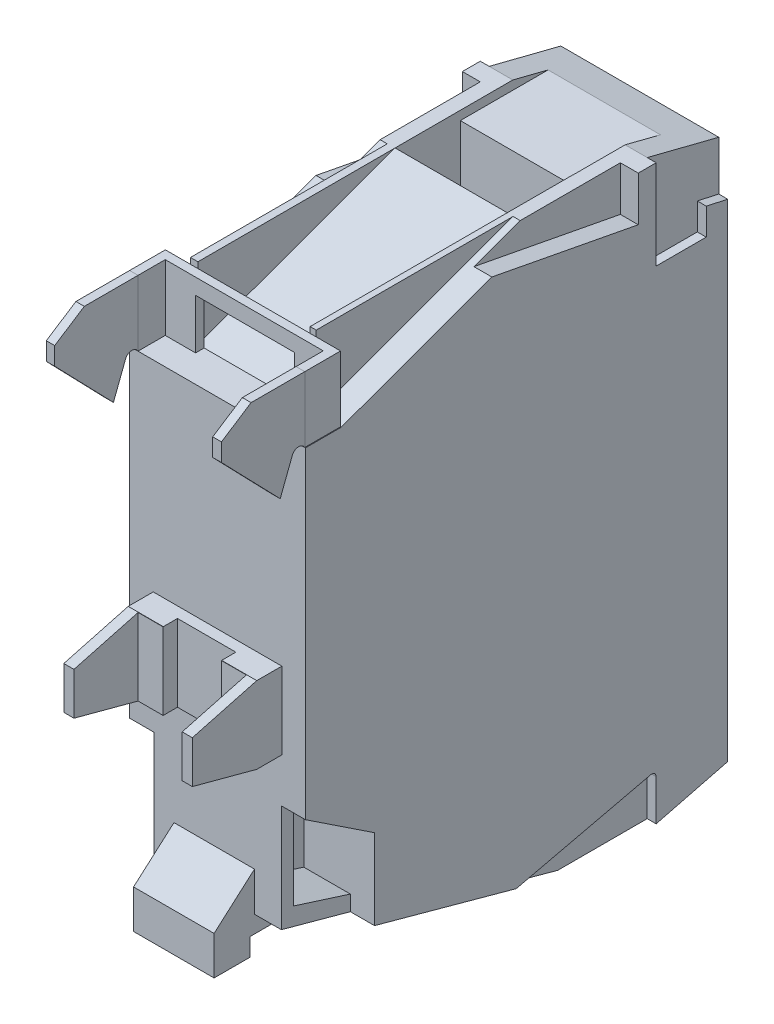
from build123d import *
from OCP.BRepFilletAPI import BRepFilletAPI_MakeChamfer

# Parameters (mm, degrees)
SKETCH1_W                = 9.83
SKETCH1_H                = 32
BOSS_EXTRUDE1_DEPTH      = 23.6
CUT_EXTRUDE1_REACH       = 32.159
CUT_EXTRUDE2_DEPTH       = 0.5
CUT_EXTRUDE3_DEPTH       = 0.5
CUT_EXTRUDE4_REACH       = 32.159
CUT_EXTRUDE5_DEPTH       = 0.5
CUT_EXTRUDE6_DEPTH       = 0.5
CUT_EXTRUDE7_REACH       = 32.159
SKETCH9_W                = 2
SKETCH9_H                = 4
CUT_EXTRUDE8_DEPTH       = 1
CUT_EXTRUDE9_DEPTH       = 1.4
CUT_EXTRUDE10_DEPTH      = 1
CUT_EXTRUDE11_DEPTH      = 1.4
CUT_EXTRUDE12_DEPTH      = 1.35
CUT_EXTRUDE13_DEPTH      = 1.35
CUT_EXTRUDE14_DEPTH      = 2.6
CUT_EXTRUDE15_DEPTH      = 3.6
SKETCH19_W               = 7.182897737
SKETCH19_H               = 2.178759377
CUT_EXTRUDE18_DEPTH      = 1.32
SKETCH21_W               = 8.285586635
SKETCH21_H               = 5.463762064
CUT_EXTRUDE19_DEPTH      = 4.25
BOSS_EXTRUDE2_DEPTH      = 2.25
BOSS_EXTRUDE2_DEPTH_BACK = 2.25
SKETCH23_W               = 6.27247625
SKETCH23_H               = 14.666987047
CUT_EXTRUDE20_DEPTH      = 4
BOSS_EXTRUDE3_REACH      = 33.466
SKETCH25_W               = 6.279577339
SKETCH25_H               = 6.156082968
CUT_EXTRUDE21_DEPTH      = 0.5
SKETCH26_W               = 7.185798512
SKETCH26_H               = 4.295592105
CUT_EXTRUDE22_DEPTH      = 31.802589265
BOSS_EXTRUDE4_DEPTH      = 5
BOSS_EXTRUDE4_DEPTH_BACK = 19.5
SKETCH27_W               = 7.185798512
SKETCH27_H               = 4.295592105
CUT_EXTRUDE23_DEPTH      = 4.295592
CHAMFER3_SIZE            = 3.6
CHAMFER3_SIZE2           = 0.964617093
CHAMFER4_SIZE            = 3.6
CHAMFER4_SIZE2           = 0.964617093
SKETCH29_W               = 3.499012957
SKETCH29_H               = 4.183403899
BOSS_EXTRUDE5_DEPTH      = 0.25
SKETCH30_R               = 2.75
SKETCH30_W               = 8.613757753
SKETCH30_H               = 3.512782784
CUT_EXTRUDE24_DEPTH      = 4
SKETCH31_R               = 2.75
CUT_EXTRUDE25_DEPTH      = 1
SKETCH32_R               = 2.75
BOSS_EXTRUDE6_DEPTH      = 0.75
BOSS_EXTRUDE6_2_DEPTH    = 0.75
SKETCH33_W               = 0.622313759
SKETCH33_H               = 4.486215778
SKETCH33_W_2             = 2.91691535
SKETCH33_H_2             = 0.583263223
SKETCH33_H_3             = 0.583263224
SKETCH33_H_4             = 4.486215777
CUT_EXTRUDE26_DEPTH      = 0.75
SKETCH35_W               = 9.791059678
SKETCH35_H               = 3.669794899
BOSS_EXTRUDE8_DEPTH      = 2
BOSS_EXTRUDE9_DEPTH      = 9.79106
SKETCH38_W               = 8.832235424
SKETCH38_H               = 8.039772077
CUT_EXTRUDE32_DEPTH      = 3.669795
CUT_EXTRUDE33_START      = -1.795116
SKETCH41_W               = 8.832235424
SKETCH41_H               = 2.428139179
CUT_EXTRUDE33_DEPTH      = 1.795116
CUT_EXTRUDE34_START      = -22.077145
SKETCH42_W               = 5.516661754
SKETCH42_H               = 2.788600357
CUT_EXTRUDE34_DEPTH      = 28.6
CUT_EXTRUDE35_DEPTH      = 0.01


with BuildPart() as part:
    # Sketch1 → Boss-Extrude1 (new body)
    with BuildSketch(Plane.XY):
        Rectangle(SKETCH1_W, SKETCH1_H)
    extrude(amount=BOSS_EXTRUDE1_DEPTH)

    # Sketch2 → Cut-Extrude1 (cut, up to next)
    with BuildSketch(Plane(origin=(4.915, 0, 0), x_dir=(0, 0, -1), z_dir=(1, 0, 0)), mode=Mode.PRIVATE) as cut_extrude1_sk1:
        Polygon((-4, 16), (0, 14.985828567), (0, 16), align=None)
    cut_extrude1_tool1 = extrude(cut_extrude1_sk1.sketch, amount=-CUT_EXTRUDE1_REACH, mode=Mode.PRIVATE) & part.part
    # Sketch2 → Cut-Extrude1 (cut, up to next)
    with BuildSketch(Plane(origin=(4.915, 0, 0), x_dir=(0, 0, -1), z_dir=(1, 0, 0)), mode=Mode.PRIVATE) as cut_extrude1_sk2:
        Polygon((0, -16), (0, -14.985828567), (-4, -16), align=None)
    cut_extrude1_tool2 = extrude(cut_extrude1_sk2.sketch, amount=-CUT_EXTRUDE1_REACH, mode=Mode.PRIVATE) & part.part
    add(cut_extrude1_tool1.solids().sort_by_distance((4.915, 15.661943, 1.333333))[0], mode=Mode.SUBTRACT)
    add(cut_extrude1_tool2.solids().sort_by_distance((4.915, -15.661943, 1.333333))[0], mode=Mode.SUBTRACT)

    # Sketch5 → Cut-Extrude2 (cut)
    with BuildSketch(Plane.ZY.offset(4.915)):
        Polygon((4, 16), (4, 11), (1.2, 11), (1.2, 12.5), (0, 12.235925398), (0, 14.985828567), align=None)
    extrude(amount=-CUT_EXTRUDE2_DEPTH, mode=Mode.SUBTRACT)

    # Sketch3 → Cut-Extrude3 (cut)
    with BuildSketch(Plane(origin=(4.915, 0, 0), x_dir=(0, 0, -1), z_dir=(1, 0, 0))):
        Polygon((-4, 16), (-4, 11), (-1.2, 11), (-1.2, 12.5), (0, 12.235925398), (0, 14.985828567), align=None)
    extrude(amount=-CUT_EXTRUDE3_DEPTH, mode=Mode.SUBTRACT)

    # Sketch6 → Cut-Extrude4 (cut, up to next)
    with BuildSketch(Plane(origin=(4.915, 0, 0), x_dir=(0, 0, -1), z_dir=(1, 0, 0)), mode=Mode.PRIVATE) as cut_extrude4_sk1:
        Polygon((-23.6, -12), (-9, -16), (-23.6, -16), align=None)
    cut_extrude4_tool1 = extrude(cut_extrude4_sk1.sketch, amount=-CUT_EXTRUDE4_REACH, mode=Mode.PRIVATE) & part.part
    add(cut_extrude4_tool1.solids().sort_by_distance((4.915, -14.666667, 18.733333))[0], mode=Mode.SUBTRACT)

    # Sketch7 → Cut-Extrude5 (cut)
    with BuildSketch(Plane(origin=(4.915, 0, 0), x_dir=(0, 0, -1), z_dir=(1, 0, 0))):
        with BuildLine():
            Line((-4, -16), (-4, -13.715163243))
            ThreePointArc((-4, -13.715163243), (-4.09463494, -13.519301818), (-4.306893584, -13.471723066))
            Line((-4.306893584, -13.471723066), (-11.819628513, -15.227499038))
            Line((-11.819628513, -15.227499038), (-9, -16))
            Line((-9, -16), (-4, -16))
        make_face()
    extrude(amount=-CUT_EXTRUDE5_DEPTH, mode=Mode.SUBTRACT)

    # Sketch8 → Cut-Extrude6 (cut)
    with BuildSketch(Plane.ZY.offset(4.915)):
        Polygon((4, -16), (4, -13.715163243), (4.09463494, -13.519301818), (4.306893584, -13.471723066), (11.819628513, -15.227499038), (9, -16), align=None)
    extrude(amount=-CUT_EXTRUDE6_DEPTH, mode=Mode.SUBTRACT)

    # Sketch9 → Cut-Extrude7 (cut, up to next)
    with BuildSketch(Plane(origin=(4.915, 0, 0), x_dir=(0, 0, -1), z_dir=(1, 0, 0)), mode=Mode.PRIVATE) as cut_extrude7_sk1:
        with Locations((-22.6, 14)):
            Rectangle(SKETCH9_W, SKETCH9_H)
    cut_extrude7_tool1 = extrude(cut_extrude7_sk1.sketch, amount=-CUT_EXTRUDE7_REACH, mode=Mode.PRIVATE) & part.part
    add(cut_extrude7_tool1.solids().sort_by_distance((4.915, 14, 22.6))[0], mode=Mode.SUBTRACT)

    # Sketch10 → Cut-Extrude8 (cut)
    with BuildSketch(Plane(origin=(4.915, 0, 0), x_dir=(0, 0, -1), z_dir=(1, 0, 0))):
        Polygon((-5, 13.5), (-5, 16), (-18.10239553, 16), align=None)
    extrude(amount=-CUT_EXTRUDE8_DEPTH, mode=Mode.SUBTRACT)

    # Sketch11 → Cut-Extrude9 (cut)
    with BuildSketch(Plane(origin=(4.915, 0, 0), x_dir=(0, 0, -1), z_dir=(1, 0, 0))):
        Polygon((-21.6, 16), (-10.6, 16), (-21.6, 12), align=None)
    extrude(amount=-CUT_EXTRUDE9_DEPTH, mode=Mode.SUBTRACT)

    # Sketch12 → Cut-Extrude10 (cut)
    with BuildSketch(Plane.ZY.offset(4.915)):
        Polygon((5, 16), (5, 13.5), (18.10239553, 16), align=None)
    extrude(amount=-CUT_EXTRUDE10_DEPTH, mode=Mode.SUBTRACT)

    # Sketch13 → Cut-Extrude11 (cut)
    with BuildSketch(Plane.ZY.offset(4.915)):
        Polygon((21.6, 12), (21.6, 16), (10.6, 16), align=None)
    extrude(amount=-CUT_EXTRUDE11_DEPTH, mode=Mode.SUBTRACT)

    # Sketch14 → Cut-Extrude12 (cut)
    with BuildSketch(Plane(origin=(4.915, 0, 0), x_dir=(0, 0, -1), z_dir=(1, 0, 0))):
        Polygon((-23.6, -12), (-23.6, -6), (-19.742166853, -8.556940588), (-19.742166853, -13.056940588), align=None)
    extrude(amount=-CUT_EXTRUDE12_DEPTH, mode=Mode.SUBTRACT)

    # Sketch15 → Cut-Extrude13 (cut)
    with BuildSketch(Plane.ZY.offset(4.915)):
        Polygon((19.742166853, -13.056940588), (19.742166853, -8.556940588), (23.6, -6), (23.6, -12), align=None)
    extrude(amount=-CUT_EXTRUDE13_DEPTH, mode=Mode.SUBTRACT)

    # Sketch16 → Cut-Extrude14 (cut)
    with BuildSketch(Plane(origin=(3.565, 0, 0), x_dir=(0, 0, -1), z_dir=(1, 0, 0))):
        Polygon((-22.922592203, -6.448980406), (-22.922592203, -11.190433252), (-19.742166853, -12.201066505), (-19.742166853, -8.556940588), align=None)
    extrude(amount=-CUT_EXTRUDE14_DEPTH, mode=Mode.SUBTRACT)

    # Sketch18 → Cut-Extrude15 (cut)
    with BuildSketch(Plane.ZY.offset(3.565)):
        Polygon((19.742166853, -12.201066505), (19.742166853, -8.556940588), (22.922592203, -6.448980406), (22.922592203, -11.190433252), align=None)
    extrude(amount=-CUT_EXTRUDE15_DEPTH, mode=Mode.SUBTRACT)

    # Sketch19 → Cut-Extrude18 (cut)
    with BuildSketch(Plane(origin=(0, -14.080667223, -3.570052614), x_dir=(1, 0, 0), z_dir=(0, -0.9693290698641888, -0.2457664629607274))):
        with Locations((0.133177719, 6.014201082)):
            Rectangle(SKETCH19_W, SKETCH19_H)
    extrude(amount=-CUT_EXTRUDE18_DEPTH, mode=Mode.SUBTRACT)

    # Chamfer2
    # the kernel refuses this chamfer: 2.799038106, 0.75 mm, written as the material it takes off along each edge
    with BuildSketch(Plane(origin=(-3.45827115, -15.826489143, 3.315654727), x_dir=(-0.9905000388259536, -0.13329481236589955, -0.033795947717498075), z_dir=(0, 0.24576646296072743, -0.9693290698641889))) as chamfer2_piece_1_section:
        with BuildLine():
            Line((0.78644901, 0), (-0.42847656, 2.875581688))
            Line((-0.42847656, 2.875581688), (-0.483925507, 2.867883636))
            ThreePointArc((-0.483925507, 2.867883636), (-0.255335983, 1.432085195), (-0.055448947, -0.007698052))
            Line((-0.055448947, -0.007698052), (0.007698052, -0.055448947))
            ThreePointArc((0.007698052, -0.055448947), (0.39348681, -0.001889377), (0.794147061, -0.055448947))
            Line((0.794147061, -0.055448947), (0.78644901, 0))
        make_face()
    chamfer2_piece_1 = extrude(amount=2.178759377, mode=Mode.PRIVATE)
    chamfer2_piece_1 = split(chamfer2_piece_1, bisect_by=Plane(origin=(-3.7390551, -14.279241778, 2.584099058), z_dir=(0, -0.9693290698641888, -0.2457664629607274)), keep=Keep.TOP, mode=Mode.PRIVATE)
    add(chamfer2_piece_1, mode=Mode.SUBTRACT)
    with BuildSketch(Plane(origin=(-3.45827115, -15.291023158, 1.203719926), x_dir=(0, 0.11013687873881672, -0.9939164290531027), z_dir=(1, 0, 0))) as chamfer2_piece_2_section:
        with BuildLine():
            Line((0.78644901, 0), (-0.42847656, 2.875581688))
            Line((-0.42847656, 2.875581688), (-0.483925507, 2.867883636))
            ThreePointArc((-0.483925507, 2.867883636), (-0.255335983, 1.432085195), (-0.055448947, -0.007698052))
            Line((-0.055448947, -0.007698052), (0.007698052, -0.055448947))
            ThreePointArc((0.007698052, -0.055448947), (0.39348681, -0.001889377), (0.794147061, -0.055448947))
            Line((0.794147061, -0.055448947), (0.78644901, 0))
        make_face()
    chamfer2_piece_2 = extrude(amount=7.182897736, mode=Mode.PRIVATE)
    chamfer2_piece_2 = split(chamfer2_piece_2, bisect_by=Plane(origin=(0.133177718, -13.942501507, 1.255959612), z_dir=(0, -0.9693290698641888, -0.2457664629607274)), keep=Keep.TOP, mode=Mode.PRIVATE)
    add(chamfer2_piece_2, mode=Mode.SUBTRACT)
    with BuildSketch(Plane(origin=(3.724626587, -15.291023158, 1.203719926), x_dir=(0.9905000388259536, -0.1332948123658999, -0.03379594771749775), z_dir=(0, -0.24576646296072743, 0.9693290698641889))) as chamfer2_piece_3_section:
        with BuildLine():
            Line((0.78644901, 0), (-0.42847656, 2.875581688))
            Line((-0.42847656, 2.875581688), (-0.483925507, 2.867883636))
            ThreePointArc((-0.483925507, 2.867883636), (-0.255335983, 1.432085195), (-0.055448947, -0.007698052))
            Line((-0.055448947, -0.007698052), (0.007698052, -0.055448947))
            ThreePointArc((0.007698052, -0.055448947), (0.39348681, -0.001889377), (0.794147061, -0.055448947))
            Line((0.794147061, -0.055448947), (0.78644901, 0))
        make_face()
    chamfer2_piece_3 = extrude(amount=2.178759377, mode=Mode.PRIVATE)
    chamfer2_piece_3 = split(chamfer2_piece_3, bisect_by=Plane(origin=(4.005410537, -14.279241778, 2.584099058), z_dir=(0, -0.9693290698641888, -0.2457664629607274)), keep=Keep.TOP, mode=Mode.PRIVATE)
    add(chamfer2_piece_3, mode=Mode.SUBTRACT)
    with BuildSketch(Plane(origin=(-10.726593775, -15.291023158, 1.203719926), x_dir=(0, 0.11013687873882122, -0.9939164290531021), z_dir=(1, 0, 0))) as chamfer2_piece_4a_section:
        with BuildLine():
            Line((0.78644901, 0), (-0.42847656, 2.875581688))
            Line((-0.42847656, 2.875581688), (-0.483925507, 2.867883636))
            ThreePointArc((-0.483925507, 2.867883636), (-0.255335983, 1.432085195), (-0.055448947, -0.007698052))
            Line((-0.055448947, -0.007698052), (0.007698052, -0.055448947))
            ThreePointArc((0.007698052, -0.055448947), (0.39348681, -0.001889377), (0.794147061, -0.055448947))
            Line((0.794147061, -0.055448947), (0.78644901, 0))
        make_face()
    chamfer2_piece_4a = extrude(amount=14.451220361, mode=Mode.PRIVATE)
    chamfer2_piece_4a = split(chamfer2_piece_4a, bisect_by=Plane(origin=(-3.45827115, -14.683152158, 1.068172929), z_dir=(-1, 0, 0)), keep=Keep.TOP, mode=Mode.PRIVATE)
    chamfer2_piece_4a = split(chamfer2_piece_4a, bisect_by=Plane(origin=(-7.092432462, -13.942501507, 1.255959612), z_dir=(0, -0.9693290698641888, -0.2457664629607274)), keep=Keep.TOP, mode=Mode.PRIVATE)
    with BuildSketch(Plane(origin=(-3.45827115, -15.826489143, 3.315654727), x_dir=(-0.9905000388259536, -0.13329481236589955, -0.033795947717498075), z_dir=(0, 0.24576646296072743, -0.9693290698641889))) as chamfer2_piece_4b_section:
        with BuildLine():
            Line((0.78644901, 0), (-0.42847656, 2.875581688))
            Line((-0.42847656, 2.875581688), (-0.483925507, 2.867883636))
            ThreePointArc((-0.483925507, 2.867883636), (-0.255335983, 1.432085195), (-0.055448947, -0.007698052))
            Line((-0.055448947, -0.007698052), (0.007698052, -0.055448947))
            ThreePointArc((0.007698052, -0.055448947), (0.39348681, -0.001889377), (0.794147061, -0.055448947))
            Line((0.794147061, -0.055448947), (0.78644901, 0))
        make_face()
    chamfer2_piece_4b = extrude(amount=9.447082002, mode=Mode.PRIVATE)
    chamfer2_piece_4b = split(chamfer2_piece_4b, bisect_by=Plane(origin=(-3.7390551, -14.752159437, 1.340344974), z_dir=(0, 0.24576646296072743, -0.9693290698641889)), keep=Keep.TOP, mode=Mode.PRIVATE)
    chamfer2_piece_4b = split(chamfer2_piece_4b, bisect_by=Plane(origin=(-3.7390551, -13.118353814, -1.994566548), z_dir=(0, -0.9693290698641888, -0.2457664629607274)), keep=Keep.TOP, mode=Mode.PRIVATE)
    chamfer2_piece_4 = chamfer2_piece_4a & chamfer2_piece_4b
    add(chamfer2_piece_4, mode=Mode.SUBTRACT)
    with BuildSketch(Plane(origin=(3.724626587, -13.504713214, -5.841676483), x_dir=(0.9905000388259537, -0.13329481236589816, -0.0337959477174973), z_dir=(0, -0.24576646296072743, 0.9693290698641889))) as chamfer2_piece_5a_section:
        with BuildLine():
            Line((0.78644901, 0), (-0.42847656, 2.875581688))
            Line((-0.42847656, 2.875581688), (-0.483925507, 2.867883636))
            ThreePointArc((-0.483925507, 2.867883636), (-0.255335983, 1.432085195), (-0.055448947, -0.007698052))
            Line((-0.055448947, -0.007698052), (0.007698052, -0.055448947))
            ThreePointArc((0.007698052, -0.055448947), (0.39348681, -0.001889377), (0.794147061, -0.055448947))
            Line((0.794147061, -0.055448947), (0.78644901, 0))
        make_face()
    chamfer2_piece_5a = extrude(amount=9.447082002, mode=Mode.PRIVATE)
    chamfer2_piece_5a = split(chamfer2_piece_5a, bisect_by=Plane(origin=(4.005410537, -14.752159437, 1.340344974), z_dir=(0, 0.24576646296072743, -0.9693290698641889)), keep=Keep.TOP, mode=Mode.PRIVATE)
    chamfer2_piece_5a = split(chamfer2_piece_5a, bisect_by=Plane(origin=(4.005410537, -13.118353814, -1.994566548), z_dir=(0, -0.9693290698641888, -0.2457664629607274)), keep=Keep.TOP, mode=Mode.PRIVATE)
    with BuildSketch(Plane(origin=(-3.45827115, -15.291023158, 1.203719926), x_dir=(0, 0.11013687873881672, -0.9939164290531027), z_dir=(1, 0, 0))) as chamfer2_piece_5b_section:
        with BuildLine():
            Line((0.78644901, 0), (-0.42847656, 2.875581688))
            Line((-0.42847656, 2.875581688), (-0.483925507, 2.867883636))
            ThreePointArc((-0.483925507, 2.867883636), (-0.255335983, 1.432085195), (-0.055448947, -0.007698052))
            Line((-0.055448947, -0.007698052), (0.007698052, -0.055448947))
            ThreePointArc((0.007698052, -0.055448947), (0.39348681, -0.001889377), (0.794147061, -0.055448947))
            Line((0.794147061, -0.055448947), (0.78644901, 0))
        make_face()
    chamfer2_piece_5b = extrude(amount=14.451220361, mode=Mode.PRIVATE)
    chamfer2_piece_5b = split(chamfer2_piece_5b, bisect_by=Plane(origin=(3.724626587, -14.683152158, 1.068172929), z_dir=(1, 0, 0)), keep=Keep.TOP, mode=Mode.PRIVATE)
    chamfer2_piece_5b = split(chamfer2_piece_5b, bisect_by=Plane(origin=(7.358787899, -13.942501507, 1.255959612), z_dir=(0, -0.9693290698641888, -0.2457664629607274)), keep=Keep.TOP, mode=Mode.PRIVATE)
    chamfer2_piece_5 = chamfer2_piece_5a & chamfer2_piece_5b
    add(chamfer2_piece_5, mode=Mode.SUBTRACT)

    # Sketch21 → Cut-Extrude19 (cut)
    with BuildSketch(Plane(origin=(0, -14.080667223, -3.570052614), x_dir=(-1, 0, 0), z_dir=(0, -0.9693290698641888, -0.2457664629607274))):
        with Locations((0.065477832, -9.835461802)):
            Rectangle(SKETCH21_W, SKETCH21_H)
    extrude(amount=-CUT_EXTRUDE19_DEPTH, mode=Mode.SUBTRACT)

    # Sketch22 → Boss-Extrude2 (add, two sides: drawn at the far end of the back side and taken through both)
    with BuildSketch(Plane(origin=(-0.185, 0, 0), x_dir=(0, 0, -1), z_dir=(1, 0, 0)).offset(-BOSS_EXTRUDE2_DEPTH_BACK)):
        Polygon((-19.858118269, -12.957237014), (-23.858118269, -12.957237014), (-23.858118269, -13.957237014), (-25.858118269, -13.957237014), (-25.858118269, -11.798752032), (-23.592707946, -9.808092274), (-23.473074349, -11.374374647), align=None)
    extrude(amount=BOSS_EXTRUDE2_DEPTH + BOSS_EXTRUDE2_DEPTH_BACK)

    # Sketch23 → Cut-Extrude20 (cut)
    with BuildSketch(Plane(origin=(0, 16, 0), x_dir=(1, 0, 0), z_dir=(0, 1, 0))):
        with Locations((0.038081978, -14.266506477)):
            Rectangle(SKETCH23_W, SKETCH23_H)
    extrude(amount=-CUT_EXTRUDE20_DEPTH, mode=Mode.SUBTRACT)

    # Sketch24 → Boss-Extrude3 (add, up to next)
    with BuildSketch(Plane.ZY.offset(-3.174320103), mode=Mode.PRIVATE) as boss_extrude3_sk1:
        Polygon((10.579716493, 16), (21.6, 12), (10.579716493, 12), align=None)
    boss_extrude3_tool1 = extrude(boss_extrude3_sk1.sketch, amount=BOSS_EXTRUDE3_REACH, mode=Mode.PRIVATE) - part.part
    add(boss_extrude3_tool1.solids().sort_by_distance((3.17432, 13.333333, 14.253144))[0])

    # Sketch25 → Cut-Extrude21 (cut)
    with BuildSketch(Plane(origin=(0, 16, 0), x_dir=(1, 0, 0), z_dir=(0, 1, 0))):
        with Locations((0.041632523, -3.854971469)):
            Rectangle(SKETCH25_W, SKETCH25_H)
    extrude(amount=-CUT_EXTRUDE21_DEPTH, mode=Mode.SUBTRACT)

    # Sketch26 → Cut-Extrude22 (cut, through all)
    with BuildSketch(Plane(origin=(0, 0, 0), x_dir=(-1, 0, 0), z_dir=(0, 0, -1))):
        with Locations((0, -1.374951584)):
            Rectangle(SKETCH26_W, SKETCH26_H)
    extrude(amount=-CUT_EXTRUDE22_DEPTH, mode=Mode.SUBTRACT)



with BuildPart() as body_2:
    # Sketch27 → Boss-Extrude4 (new, two sides: drawn at the far end of the back side and taken through both)
    with BuildSketch(Plane.XY.offset(23.6).offset(-BOSS_EXTRUDE4_DEPTH_BACK)):
        with Locations((0, -1.374951584)):
            Rectangle(SKETCH27_W, SKETCH27_H)
    extrude(amount=BOSS_EXTRUDE4_DEPTH + BOSS_EXTRUDE4_DEPTH_BACK)

    # Sketch28 → Cut-Extrude23 (cut)
    with BuildSketch(Plane(origin=(0, 0.772844468, 0), x_dir=(1, 0, 0), z_dir=(0, 1, 0))):
        Polygon((-3.024869573, -28.6), (0, -28.6), (0, -24.208534676), (-1.631367449, -24.208534676), (-1.631367449, -25.013795774), (-3.024869573, -25.013795774), align=None)
        Polygon((0, -28.6), (3.024869573, -28.6), (3.024869573, -25.013795774), (1.631367449, -25.013795774), (1.631367449, -24.208534676), (0, -24.208534676), align=None)
    extrude(amount=-CUT_EXTRUDE23_DEPTH, mode=Mode.SUBTRACT)

    # Chamfer3: one chamfer whose edges measure the first distance from different faces: ONE call of the kernel's chamfer builder (chamfer() names one face for all edges)
    chamfer3_edges_1 = [body_2.edges().sort_by_distance(p)[0] for p in [
        (3.308884414, 0.772844468, 28.6),
    ]]
    chamfer3_side_1 = [body_2.faces().sort_by_distance(p)[0] for p in [
        (0, 0.772844468, 14.711727186),
    ]]
    chamfer3_edges_2 = [body_2.edges().sort_by_distance(p)[0] for p in [
        (3.308884414, -3.522747637, 28.6),
    ]]
    chamfer3_side_2 = [body_2.faces().sort_by_distance(p)[0] for p in [
        (0, -3.522747637, 14.711727186),
    ]]
    chamfer3 = BRepFilletAPI_MakeChamfer(body_2.part.solid().wrapped)
    for e in chamfer3_edges_1:
        chamfer3.Add(CHAMFER3_SIZE, CHAMFER3_SIZE2, e.wrapped, chamfer3_side_1[0].wrapped)  # the first distance lies on this face
    for e in chamfer3_edges_2:
        chamfer3.Add(CHAMFER3_SIZE, CHAMFER3_SIZE2, e.wrapped, chamfer3_side_2[0].wrapped)  # the first distance lies on this face
    add(Compound.cast(chamfer3.Shape()), mode=Mode.REPLACE)

    # Chamfer4: one chamfer whose edges measure the first distance from different faces: ONE call of the kernel's chamfer builder (chamfer() names one face for all edges)
    chamfer4_edges_1 = [body_2.edges().sort_by_distance(p)[0] for p in [
        (-3.308884414, 0.772844468, 28.6),
    ]]
    chamfer4_side_1 = [body_2.faces().sort_by_distance(p)[0] for p in [
        (-0.045509092, 0.772844468, 14.545239935),
    ]]
    chamfer4_edges_2 = [body_2.edges().sort_by_distance(p)[0] for p in [
        (-3.308884414, -3.522747637, 28.6),
    ]]
    chamfer4_side_2 = [body_2.faces().sort_by_distance(p)[0] for p in [
        (-0.045509092, -3.522747637, 14.545239935),
    ]]
    chamfer4 = BRepFilletAPI_MakeChamfer(body_2.part.solid().wrapped)
    for e in chamfer4_edges_1:
        chamfer4.Add(CHAMFER4_SIZE, CHAMFER4_SIZE2, e.wrapped, chamfer4_side_1[0].wrapped)  # the first distance lies on this face
    for e in chamfer4_edges_2:
        chamfer4.Add(CHAMFER4_SIZE, CHAMFER4_SIZE2, e.wrapped, chamfer4_side_2[0].wrapped)  # the first distance lies on this face
    add(Compound.cast(chamfer4.Shape()), mode=Mode.REPLACE)


with BuildPart() as part_1:
    add(part.part)

    add(body_2.part)  # Boss-Extrude5 merges body 2
    # Sketch29 → Boss-Extrude5 (add)
    with BuildSketch(Plane(origin=(0, 0, 4.1), x_dir=(-1, 0, 0), z_dir=(0, 0, -1))):
        with Locations((-0.007925079, -1.431045688)):
            Rectangle(SKETCH29_W, SKETCH29_H)
    extrude(amount=BOSS_EXTRUDE5_DEPTH)

    # Sketch30 → Cut-Extrude24 (cut)
    with BuildSketch(Plane(origin=(0, 0, 0), x_dir=(-1, 0, 0), z_dir=(0, 0, -1))):
        with Locations((0, 9.681432772)):
            Circle(SKETCH30_R)
        with Locations((0, -10.236294495)):
            Circle(SKETCH30_R)
        with Locations((-0.080372339, 9.625466097)):
            Rectangle(SKETCH30_W, SKETCH30_H)
    extrude(amount=-CUT_EXTRUDE24_DEPTH, mode=Mode.SUBTRACT)

    # Sketch31 → Cut-Extrude25 (cut)
    with BuildSketch(Plane(origin=(0, 0, 4), x_dir=(-1, 0, 0), z_dir=(0, 0, -1))):
        with Locations((0, 9.681432772)):
            Circle(SKETCH31_R)
        with Locations((0, -10.236294495)):
            Circle(SKETCH31_R)
    extrude(amount=-CUT_EXTRUDE25_DEPTH, mode=Mode.SUBTRACT)

    # Sketch43 → Cut-Extrude35 (cut)
    # profile 1 of 4: a face of its own
    with BuildSketch(Plane(origin=(0, 0, 0), x_dir=(-1, 0, 0), z_dir=(0, 0, -1))):
        Polygon((-0.670175641, 1.057778526), (-0.670175641, 3.16066481), (-0.636054289, 3.16066481), (0.381267501, 1.592346373), (0.381267501, 3.16066481), (0.543027985, 3.16066481), (0.543027985, 1.057778526), (0.506379125, 1.057778526), (-0.508415158, 2.622305701), (-0.508415158, 1.057778526), align=None)
    # profile 2 of 4: a face of its own
    with BuildSketch(Plane(origin=(0, 0, 0), x_dir=(-1, 0, 0), z_dir=(0, 0, -1))):
        with BuildLine():
            add(Edge.make_bspline(
                [(1.533136944, 3.214584971), (1.561700732, 3.213597891), (1.617954285, 3.211653934), (1.700636083, 3.196677579), (1.779337274, 3.170894315), (1.855162033, 3.136456937), (1.926560461, 3.090691979), (1.994481098, 3.035392363), (2.058660731, 2.969954022), (2.11861502, 2.895429157), (2.173346139, 2.813987497), (2.221308287, 2.72702707), (2.261593855, 2.635443626), (2.295196036, 2.539330069), (2.32073291, 2.438512594), (2.338693626, 2.333003502), (2.34986739, 2.223059753), (2.35131405, 2.148144014), (2.352049391, 2.11006417)],
                knots=[0, 0, 0, 0, 0.898098036, 1.768715194, 2.63185109, 3.497379012, 4.380773147, 5.291241178, 6.24686274, 7.258020093, 8.295511944, 9.329312446, 10.37727006, 11.438773534, 12.52813492, 13.64410021, 14.802490707, 16, 16, 16, 16], degree=3))
            add(Edge.make_bspline(
                [(2.352049391, 2.11006417), (2.351316559, 2.072264533), (2.349874989, 1.997907984), (2.338654745, 1.888672524), (2.320754304, 1.783712493), (2.295064006, 1.68308339), (2.261621471, 1.586987433), (2.221592312, 1.494948773), (2.173902233, 1.40747555), (2.119012059, 1.32568428), (2.059555268, 1.250713404), (1.996034874, 1.184845613), (1.929479582, 1.128595986), (1.858813122, 1.083230319), (1.785295158, 1.047266613), (1.708084473, 1.022517027), (1.628006643, 1.006650293), (1.57337113, 1.00479532), (1.545774482, 1.003858364)],
                knots=[0, 0, 0, 0, 1.197173147, 2.35498725, 3.474542017, 4.567376407, 5.640664965, 6.694317375, 7.743302753, 8.79190142, 9.810962082, 10.77037363, 11.686136886, 12.564596685, 13.424010597, 14.27078521, 15.126565658, 16, 16, 16, 16], degree=3))
            add(Edge.make_bspline(
                [(1.545774482, 1.003858364), (1.517755613, 1.004778244), (1.462558468, 1.006590407), (1.381654045, 1.02255904), (1.303963031, 1.047270334), (1.22967416, 1.082697496), (1.158851055, 1.128211432), (1.091584261, 1.184084132), (1.027491282, 1.249574073), (0.967917421, 1.32442004), (0.913103256, 1.405692855), (0.865337429, 1.492604984), (0.824805431, 1.583615389), (0.792115804, 1.679021754), (0.765554436, 1.778137127), (0.747924171, 1.881804067), (0.736598241, 1.989474429), (0.735170511, 2.062714153), (0.734444557, 2.09995414)],
                knots=[0, 0, 0, 0, 0.889698157, 1.752704555, 2.610781366, 3.475148265, 4.36027932, 5.279668441, 6.248493922, 7.267455478, 8.315828649, 9.360471756, 10.415340803, 11.4780818, 12.562710894, 13.67279411, 14.816692451, 16, 16, 16, 16], degree=3))
            add(Edge.make_bspline(
                [(0.734444557, 2.09995414), (0.734762541, 2.124957173), (0.735393805, 2.174593345), (0.740626897, 2.248391529), (0.748945622, 2.32094296), (0.760895675, 2.392018604), (0.775356356, 2.461886541), (0.794275601, 2.530040043), (0.815331654, 2.59721216), (0.840991088, 2.662156731), (0.868160719, 2.72523197), (0.899249359, 2.784590924), (0.931950001, 2.840668213), (0.966977675, 2.893363111), (1.005023671, 2.942079509), (1.045075314, 2.987826083), (1.087580136, 3.030095634), (1.132735782, 3.068226265), (1.179049272, 3.10285293), (1.227043898, 3.132309869), (1.275558725, 3.157959473), (1.325265345, 3.178446849), (1.375788986, 3.194801458), (1.427453938, 3.205929524), (1.479970315, 3.213594504), (1.515417148, 3.214254861), (1.533136944, 3.214584971)],
                knots=[0, 0, 0, 0, 1.18779751, 2.358022776, 3.513223797, 4.656049071, 5.78131175, 6.90122214, 8.015195336, 9.124022669, 10.217307805, 11.276559585, 12.305179136, 13.300639859, 14.280122778, 15.239705743, 16.187904133, 17.124983385, 18.045651851, 18.932437722, 19.797784769, 20.650176787, 21.483559843, 22.31715649, 23.158750153, 24, 24, 24, 24], degree=3))
        make_face()
        with BuildLine():
            add(Edge.make_bspline(
                [(1.540298215, 2.998904327), (1.526233086, 2.998655313), (1.498116175, 2.998157522), (1.456441134, 2.991800466), (1.41525759, 2.982624656), (1.374555165, 2.969566596), (1.334632509, 2.951974967), (1.294881473, 2.931480786), (1.255981684, 2.906769786), (1.217975943, 2.878605985), (1.180851063, 2.847786513), (1.146396824, 2.813249172), (1.113427589, 2.776708745), (1.082658117, 2.737404812), (1.053986842, 2.695604144), (1.027305527, 2.65119894), (1.002993805, 2.60398918), (0.973150881, 2.537532431), (0.941973869, 2.449592913), (0.915737598, 2.338438581), (0.899257653, 2.221484686), (0.897236419, 2.141573233), (0.89620504, 2.100796643)],
                knots=[0, 0, 0, 0, 0.69080667, 1.380957812, 2.067509705, 2.763846352, 3.478051512, 4.209754039, 4.960451631, 5.740469969, 6.53411279, 7.329704307, 8.136239662, 8.952318061, 9.781342389, 10.626559184, 11.497156162, 12.39004269, 14.206448916, 16.073176327, 17.996251157, 20, 20, 20, 20], degree=3))
            add(Edge.make_bspline(
                [(0.89620504, 2.100796643), (0.896748936, 2.070444297), (0.897816467, 2.010870327), (0.906869008, 1.923435974), (0.921525224, 1.839637946), (0.942189929, 1.759334246), (0.968682665, 1.68249635), (1.00118947, 1.609316556), (1.039777497, 1.539888346), (1.08357684, 1.474756622), (1.131505004, 1.415256599), (1.182587214, 1.363196145), (1.235869922, 1.318775588), (1.291970847, 1.282759232), (1.350310412, 1.253948415), (1.411688305, 1.234397036), (1.475160375, 1.221431843), (1.518469214, 1.220173336), (1.540298215, 1.219539009)],
                knots=[0, 0, 0, 0, 1.205828846, 2.366736765, 3.488627291, 4.583440392, 5.658048122, 6.714615049, 7.761100947, 8.810320197, 9.829863525, 10.792568903, 11.704148379, 12.580147425, 13.436086057, 14.281263722, 15.133703506, 16, 16, 16, 16], degree=3))
            add(Edge.make_bspline(
                [(1.540298215, 1.219539009), (1.555060517, 1.219819083), (1.584268865, 1.220373231), (1.627674137, 1.226154327), (1.670150479, 1.235243421), (1.71174311, 1.24862293), (1.75257251, 1.265063572), (1.79290277, 1.284660743), (1.83158436, 1.309250106), (1.869941258, 1.336211154), (1.90629722, 1.367217194), (1.941554478, 1.400215642), (1.973804625, 1.436890414), (2.004756775, 1.475391787), (2.032955207, 1.517161001), (2.059590454, 1.56114082), (2.083508373, 1.608342929), (2.113479766, 1.674680519), (2.144173303, 1.762800699), (2.17149396, 1.873563578), (2.187042097, 1.990268541), (2.189191701, 2.0698601), (2.190288908, 2.110485422)],
                knots=[0, 0, 0, 0, 0.72427627, 1.433036217, 2.145540229, 2.854031987, 3.574658326, 4.305237455, 5.051229374, 5.822060536, 6.604879318, 7.394707115, 8.190378355, 8.999901777, 9.818181477, 10.662213267, 11.522304177, 12.413938866, 14.23429596, 16.093327249, 18.005946367, 20, 20, 20, 20], degree=3))
            add(Edge.make_bspline(
                [(2.190288908, 2.110485422), (2.190100607, 2.130855277), (2.189727484, 2.171218668), (2.185104715, 2.230914735), (2.179100283, 2.289305144), (2.169830505, 2.346131802), (2.157541699, 2.401349693), (2.142763288, 2.455053791), (2.12545132, 2.507347705), (2.105829726, 2.55819545), (2.083501017, 2.606954059), (2.059078054, 2.653393135), (2.032521238, 2.697306677), (2.003812756, 2.738659691), (1.973065871, 2.777688228), (1.939664516, 2.813689556), (1.904661544, 2.847798091), (1.86726371, 2.878628087), (1.82881912, 2.906774127), (1.789501519, 2.931490781), (1.749325908, 2.951970157), (1.708872345, 2.969657934), (1.667431901, 2.982621197), (1.625547857, 2.991757343), (1.583182575, 2.99818394), (1.554644682, 2.99866333), (1.540298215, 2.998904327)],
                knots=[0, 0, 0, 0, 1.204721978, 2.387187502, 3.540257008, 4.676447593, 5.790963516, 6.885236545, 7.970105355, 9.048371206, 10.107754043, 11.140721927, 12.150757252, 13.141584239, 14.117147119, 15.087177461, 16.044750807, 17.006207391, 17.951597559, 18.862038203, 19.749956506, 20.617076847, 21.470885692, 22.313304485, 23.152070474, 24, 24, 24, 24], degree=3))
        make_face(mode=Mode.SUBTRACT)
    # profile 3 of 4: a face of its own
    with BuildSketch(Plane(origin=(0, 0, 0), x_dir=(-1, 0, 0), z_dir=(0, 0, -1))):
        with BuildLine():
            Line((3.001735558, 3.550051598), (2.71679966, 3.550051598))
            add(Edge.make_bspline(
                [(2.71679966, 3.550051598), (2.724519038, 3.582012494), (2.739609791, 3.644493432), (2.771085447, 3.733762875), (2.805374771, 3.818239213), (2.846549173, 3.896340651), (2.891460686, 3.969636798), (2.942916298, 4.036465218), (2.998542046, 4.098525551), (3.060068964, 4.153601131), (3.124592822, 4.203473786), (3.193022798, 4.245996159), (3.263982138, 4.282575926), (3.33796248, 4.312711422), (3.415184078, 4.335413147), (3.494948808, 4.351883964), (3.577465697, 4.362580189), (3.633479583, 4.363624095), (3.661921856, 4.364154162)],
                knots=[0, 0, 0, 0, 1.162005537, 2.271625781, 3.343758855, 4.383309926, 5.390229558, 6.379919256, 7.361854164, 8.333198761, 9.295911338, 10.242430842, 11.177959212, 12.116337295, 13.062827104, 14.020064771, 14.994644689, 16, 16, 16, 16], degree=3))
            add(Edge.make_bspline(
                [(3.661921856, 4.364154162), (3.703362629, 4.362903003), (3.785340232, 4.360427976), (3.905775281, 4.337827023), (4.021913896, 4.302062796), (4.132484856, 4.252647344), (4.235190149, 4.191698852), (4.326572261, 4.119159413), (4.405392553, 4.036428618), (4.471518167, 3.945049791), (4.523293345, 3.847390865), (4.561471698, 3.746879294), (4.584714223, 3.643753506), (4.587726442, 3.574123688), (4.589235558, 3.539239298)],
                knots=[0, 0, 0, 0, 1.083050992, 2.142477498, 3.193116406, 4.255571735, 5.30263384, 6.308962982, 7.297363603, 8.282367274, 9.249857812, 10.179914175, 11.08814088, 12, 12, 12, 12], degree=3))
            add(Edge.make_bspline(
                [(4.589235558, 3.539239298), (4.588180014, 3.505668848), (4.58611448, 3.439976688), (4.568576047, 3.344072187), (4.539061008, 3.253683021), (4.498176295, 3.168428681), (4.445252175, 3.08884972), (4.381141942, 3.01476709), (4.305393099, 2.945852211), (4.247990063, 2.906373832), (4.21843728, 2.886049194)],
                knots=[0, 0, 0, 0, 1.024540389, 2.004866551, 2.965041327, 3.920577974, 4.882998113, 5.874504559, 6.905732034, 8, 8, 8, 8], degree=3))
            add(Edge.make_bspline(
                [(4.21843728, 2.886049194), (4.252211801, 2.869740424), (4.319128894, 2.837428034), (4.410342588, 2.774058882), (4.493144661, 2.700892053), (4.539321606, 2.643794075), (4.562522817, 2.615105684)],
                knots=[0, 0, 0, 0, 1.015518401, 2.012035669, 3.001164323, 4, 4, 4, 4], degree=3))
            add(Edge.make_bspline(
                [(4.562522817, 2.615105684), (4.577800321, 2.594189009), (4.608105148, 2.552698185), (4.645511668, 2.485990142), (4.679447078, 2.418542719), (4.705890492, 2.348548115), (4.726368214, 2.276817596), (4.7410059, 2.203227993), (4.750099228, 2.127719216), (4.751401479, 2.076635752), (4.75205607, 2.050958048)],
                knots=[0, 0, 0, 0, 1.025084078, 2.033381695, 3.024893161, 4.013698104, 4.991890475, 5.976764909, 6.982997093, 8, 8, 8, 8], degree=3))
            add(Edge.make_bspline(
                [(4.75205607, 2.050958048), (4.75042819, 2.006499229), (4.747180091, 1.917790816), (4.718147823, 1.786731604), (4.673141527, 1.658619899), (4.60922702, 1.536087723), (4.531332923, 1.421442663), (4.438661636, 1.318866297), (4.332266108, 1.230693278), (4.213606698, 1.157023999), (4.085049018, 1.09813417), (3.947548302, 1.057260632), (3.803085753, 1.030639618), (3.704019133, 1.027784959), (3.653653626, 1.026333649)],
                knots=[0, 0, 0, 0, 0.955779014, 1.907060117, 2.875433937, 3.871313158, 4.872415639, 5.851225146, 6.836215519, 7.83643374, 8.849228613, 9.86973379, 10.916971861, 12, 12, 12, 12], degree=3))
            add(Edge.make_bspline(
                [(3.653653626, 1.026333649), (3.619708976, 1.027121242), (3.552917222, 1.028670964), (3.454724905, 1.039265123), (3.360997364, 1.058614485), (3.271607871, 1.084652484), (3.186477017, 1.117664992), (3.105864579, 1.158775526), (3.029274604, 1.207136674), (2.957429841, 1.263319286), (2.890338855, 1.326167358), (2.829784598, 1.396796603), (2.7747575, 1.473901391), (2.726730963, 1.558377306), (2.683517442, 1.649132647), (2.647974717, 1.747329499), (2.61669138, 1.852090004), (2.602146737, 1.925094812), (2.594684276, 1.962551598)],
                knots=[0, 0, 0, 0, 1.048658725, 2.063410685, 3.046034179, 4.001477787, 4.936774919, 5.862367409, 6.792675028, 7.730719943, 8.675894397, 9.627829632, 10.600096036, 11.597688215, 12.626045268, 13.701542398, 14.82072376, 16, 16, 16, 16], degree=3))
            Line((2.594684276, 1.962551598), (2.879620173, 1.962551598))
            add(Edge.make_bspline(
                [(2.879620173, 1.962551598), (2.887043587, 1.938104993), (2.901482773, 1.890554223), (2.926061172, 1.822119088), (2.954063105, 1.759382854), (2.98410274, 1.701885308), (3.015651759, 1.6490602), (3.050953155, 1.602304362), (3.087392308, 1.559564142), (3.114860007, 1.535484387), (3.128303066, 1.523699434)],
                knots=[0, 0, 0, 0, 1.198163088, 2.33053128, 3.407730985, 4.417276592, 5.372219308, 6.28897303, 7.162600585, 8, 8, 8, 8], degree=3))
            add(Edge.make_bspline(
                [(3.128303066, 1.523699434), (3.14607996, 1.509994017), (3.181578876, 1.482625488), (3.239425771, 1.447699011), (3.300263203, 1.417435795), (3.365409372, 1.394318442), (3.433458485, 1.374744422), (3.505510452, 1.361935093), (3.580929599, 1.353146538), (3.63242607, 1.352370993), (3.658741768, 1.351974674)],
                knots=[0, 0, 0, 0, 0.946170439, 1.889420265, 2.845303464, 3.807233317, 4.801018734, 5.828864929, 6.890507805, 8, 8, 8, 8], degree=3))
            add(Edge.make_bspline(
                [(3.658741768, 1.351974674), (3.688453873, 1.352533389), (3.746553332, 1.353625906), (3.83133024, 1.363673154), (3.911981996, 1.378305743), (3.98761315, 1.400905378), (4.059214396, 1.428828007), (4.125782035, 1.463887632), (4.188189932, 1.505021773), (4.245638749, 1.551775152), (4.29729646, 1.602957508), (4.342780161, 1.656490794), (4.381446818, 1.712149297), (4.412637636, 1.770241021), (4.437267063, 1.830525407), (4.454033967, 1.893171631), (4.465692127, 1.957667008), (4.466641554, 2.001508287), (4.467120173, 2.02360929)],
                knots=[0, 0, 0, 0, 1.217147791, 2.380027433, 3.494444702, 4.572153297, 5.609568379, 6.639424714, 7.649109417, 8.668170816, 9.669597737, 10.625200337, 11.543417969, 12.441394052, 13.322311151, 14.205496177, 15.095365482, 16, 16, 16, 16], degree=3))
            add(Edge.make_bspline(
                [(4.467120173, 2.02360929), (4.465731971, 2.053192433), (4.462962474, 2.112211518), (4.441818263, 2.199041031), (4.407039436, 2.282700841), (4.358350801, 2.361763594), (4.299081961, 2.435038876), (4.229808081, 2.500418006), (4.149953903, 2.554365875), (4.076457307, 2.591639156), (4.011356058, 2.617072788), (3.955643531, 2.634013649), (3.893271469, 2.648358894), (3.824994138, 2.661705026), (3.750297078, 2.673063677), (3.669261609, 2.682535896), (3.581871311, 2.690115112), (3.521372896, 2.693499748), (3.490197096, 2.695243905)],
                knots=[0, 0, 0, 0, 1.07054697, 2.135767047, 3.216561865, 4.33974944, 5.486079747, 6.621378074, 7.775625952, 8.963672916, 9.598146892, 10.304877434, 11.070270905, 11.915000392, 12.823868403, 13.805723172, 14.86925407, 16, 16, 16, 16], degree=3))
            Line((3.490197096, 2.695243905), (3.490197096, 3.020884931))
            add(Edge.make_bspline(
                [(3.490197096, 3.020884931), (3.529477439, 3.021551503), (3.606417982, 3.022857154), (3.718807816, 3.038648706), (3.826280035, 3.060493276), (3.926452865, 3.093953414), (4.017755626, 3.132815684), (4.09696698, 3.178038759), (4.162977177, 3.228307853), (4.215465435, 3.284398863), (4.254952664, 3.344556085), (4.283824116, 3.407254767), (4.300878698, 3.473044451), (4.303155324, 3.517943185), (4.30429966, 3.540511333)],
                knots=[0, 0, 0, 0, 1.321986639, 2.589447074, 3.816329219, 5.01088745, 6.139805852, 7.153945165, 8.075214402, 8.924034688, 9.728124013, 10.488707548, 11.240355623, 12, 12, 12, 12], degree=3))
            add(Edge.make_bspline(
                [(4.30429966, 3.540511333), (4.30392373, 3.557091859), (4.303175835, 3.590078029), (4.293744019, 3.638270056), (4.279570782, 3.684988771), (4.260085599, 3.730035499), (4.234005062, 3.773097819), (4.202793917, 3.814542862), (4.165629997, 3.854134004), (4.12304377, 3.891036865), (4.077313061, 3.926206102), (4.027193623, 3.956063473), (3.974196636, 3.981595065), (3.918263428, 4.002649399), (3.859212483, 4.018487467), (3.797321248, 4.029859266), (3.732471707, 4.036969139), (3.688228778, 4.037992773), (3.665737961, 4.038513136)],
                knots=[0, 0, 0, 0, 0.884392785, 1.759457502, 2.611959086, 3.489218968, 4.37281399, 5.2945488, 6.255912374, 7.266815255, 8.301784654, 9.332968512, 10.37626691, 11.440494194, 12.520033166, 13.637162961, 14.798855837, 16, 16, 16, 16], degree=3))
            add(Edge.make_bspline(
                [(3.665737961, 4.038513136), (3.629586805, 4.037250972), (3.55897519, 4.034785672), (3.457180229, 4.013192938), (3.362547691, 3.978741391), (3.290213329, 3.937617866), (3.236798422, 3.89702283), (3.198628628, 3.861569522), (3.161145022, 3.822169746), (3.126813587, 3.776396792), (3.092093623, 3.727350489), (3.060484627, 3.672537578), (3.029769049, 3.613387878), (3.011261022, 3.571572552), (3.001735558, 3.550051598)],
                knots=[0, 0, 0, 0, 1.472543308, 2.876219568, 4.221790263, 5.565193594, 6.249813518, 6.953379497, 7.687249741, 8.463570142, 9.283606569, 10.136032583, 11.040678096, 12, 12, 12, 12], degree=3))
        make_face()
    # profile 4 of 4: a face of its own
    with BuildSketch(Plane(origin=(0, 0, 0), x_dir=(-1, 0, 0), z_dir=(0, 0, -1))):
        Polygon((4.015047457, -4.314501238), (4.072925061, -4.314501238), (4.072925061, -6.512578161), (4.439271215, -6.512578161), (4.439271215, -6.838219186), (4.072925061, -6.838219186), (4.072925061, -7.570911494), (3.787989163, -7.570911494), (3.787989163, -6.838219186), (2.28189942, -6.838219186), align=None)
        Polygon((3.787989163, -6.512578161), (3.787989163, -5.133691943), (2.841594933, -6.512578161), align=None, mode=Mode.SUBTRACT)
    extrude(amount=-CUT_EXTRUDE35_DEPTH, mode=Mode.SUBTRACT)


with BuildPart() as body_2_2:
    # Sketch32 → Boss-Extrude6 (new body)
    with BuildSketch(Plane(origin=(0, 0, 5), x_dir=(-1, 0, 0), z_dir=(0, 0, -1))):
        with Locations((0, 9.681432772)):
            Circle(SKETCH32_R)
    extrude(amount=BOSS_EXTRUDE6_DEPTH)


with BuildPart() as body_3:
    # Sketch32 → Boss-Extrude6 2 (new body)
    with BuildSketch(Plane(origin=(0, 0, 5), x_dir=(-1, 0, 0), z_dir=(0, 0, -1))):
        with Locations((0, -10.236294495)):
            Circle(SKETCH32_R)
    extrude(amount=BOSS_EXTRUDE6_2_DEPTH)


with BuildPart() as cut_extrude26_tool:
    # Sketch33 → Cut-Extrude26 (new body)
    with BuildSketch(Plane(origin=(0, 0, 4.25), x_dir=(-1, 0, 0), z_dir=(0, 0, -1))):
        with Locations((-0.012180533, 9.635108008)):
            Rectangle(SKETCH33_W, SKETCH33_H)
        with Locations((0, 9.681432773)):
            Rectangle(SKETCH33_W_2, SKETCH33_H_2)
        with Locations((0, -10.236294495)):
            Rectangle(SKETCH33_W_2, SKETCH33_H_3)
        with Locations((-0.012180533, -10.18996973)):
            Rectangle(SKETCH33_W, SKETCH33_H_4)
    extrude(amount=-CUT_EXTRUDE26_DEPTH)


with BuildPart() as body_2_2_1:
    add(body_2_2.part)

    # Cut-Extrude26: cut by cut_extrude26_tool
    add(cut_extrude26_tool.part, mode=Mode.SUBTRACT)


with BuildPart() as body_3_1:
    add(body_3.part)

    # Cut-Extrude26: cut by cut_extrude26_tool
    add(cut_extrude26_tool.part, mode=Mode.SUBTRACT)


with BuildPart() as body_4:
    # Sketch35 → Boss-Extrude8 (new body)
    with BuildSketch(Plane.XY.offset(21.6)):
        with Locations((-0.019470161, 13.83489745)):
            Rectangle(SKETCH35_W, SKETCH35_H)
    extrude(amount=BOSS_EXTRUDE8_DEPTH)


with BuildPart() as body_5:
    # Sketch37 → Boss-Extrude9 (new body)
    with BuildSketch(Plane.ZY.offset(4.915)):
        with BuildLine():
            Line((23.6, 15.669794899), (26.6, 15.669794899))
            Line((26.6, 15.669794899), (28.257106334, 14.598705198))
            Line((28.257106334, 14.598705198), (28.257106334, 13.598705198))
            Line((28.257106334, 13.598705198), (24.973777927, 10.204883845))
            Line((24.973777927, 10.204883845), (24.282154385, 12.000406968))
            ThreePointArc((24.282154385, 12.000406968), (23.940953368, 12.20775566), (23.6, 12))
            Line((23.6, 12), (23.6, 15.669794899))
        make_face()
    extrude(amount=-BOSS_EXTRUDE9_DEPTH)


with BuildPart() as cut_extrude32_tool:
    # Sketch38 → Cut-Extrude32 (new body)
    with BuildSketch(Plane(origin=(0, 15.669794899, 0), x_dir=(1, 0, 0), z_dir=(0, 1, 0))):
        with Locations((-0.02919907, -26.097031493)):
            Rectangle(SKETCH38_W, SKETCH38_H)
    extrude(amount=-CUT_EXTRUDE32_DEPTH)


with BuildPart() as body_4_1:
    add(body_4.part)

    # Cut-Extrude32: cut by cut_extrude32_tool
    add(cut_extrude32_tool.part, mode=Mode.SUBTRACT)

    # Sketch42 → Cut-Extrude34 (cut)
    with BuildSketch(Plane.XY.offset(22.077145454).offset(CUT_EXTRUDE34_START)):
        with Locations((0.007724321, 13.394300178)):
            Rectangle(SKETCH42_W, SKETCH42_H)
    extrude(amount=CUT_EXTRUDE34_DEPTH, mode=Mode.SUBTRACT)


with BuildPart() as body_5_1:
    add(body_5.part)

    # Cut-Extrude32: cut by cut_extrude32_tool
    add(cut_extrude32_tool.part, mode=Mode.SUBTRACT)

    # Sketch41 → Cut-Extrude33 (cut)
    with BuildSketch(Plane(origin=(0, 12, 0), x_dir=(1, 0, 0), z_dir=(0, 1, 0)).offset(CUT_EXTRUDE33_START)):
        with Locations((-0.02919907, -25.496380736)):
            Rectangle(SKETCH41_W, SKETCH41_H)
    extrude(amount=CUT_EXTRUDE33_DEPTH, mode=Mode.SUBTRACT)


with BuildPart() as cut_extrude33_piece_1:
    # of the separate pieces the step leaves, piece 1, a body of its own (cut_extrude33_pieces)
    add(body_5_1.part.solids().sort_by_distance((4.386918642, 15.669794899, 23.6))[0])


with BuildPart() as cut_extrude33_piece_2:
    # of the separate pieces the step leaves, piece 2, a body of its own (cut_extrude33_pieces)
    add(body_5_1.part.solids().sort_by_distance((-4.915, 15.669794899, 23.6))[0])


solid = Compound([part_1.part, body_2_2_1.part, body_3_1.part, body_4_1.part, cut_extrude33_piece_1.part, cut_extrude33_piece_2.part])
